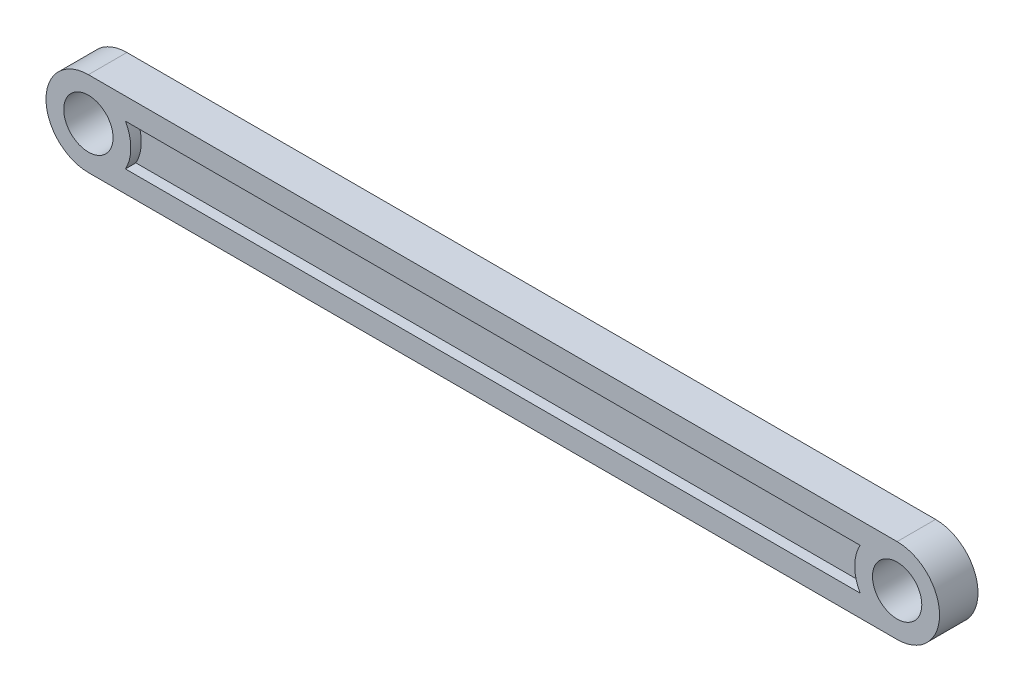
from build123d import *

# Parameters (mm, degrees)
SKETCH1_R           = 2.5
BOSS_EXTRUDE1_DEPTH = 1.95
CUT_EXTRUDE1_DEPTH  = 1.06


with BuildPart() as part:
    # Sketch1 → Boss-Extrude1 (new, symmetric)
    with BuildSketch(Plane.XY):
        with BuildLine():
            Line((41, -4.3), (-41, -4.3))
            ThreePointArc((-41, -4.3), (-45.3, 0), (-41, 4.3))
            Line((-41, 4.3), (41, 4.3))
            ThreePointArc((41, 4.3), (45.3, 0), (41, -4.3))
        make_face()
        with Locations((-41, 0)):
            Circle(SKETCH1_R, mode=Mode.SUBTRACT)
        with Locations((41, 0)):
            Circle(SKETCH1_R, mode=Mode.SUBTRACT)
    extrude(amount=BOSS_EXTRUDE1_DEPTH, both=True)

    # Sketch2 → Cut-Extrude1 (cut)
    with BuildSketch(Plane.XY.offset(1.95)):
        with BuildLine():
            ThreePointArc((37.247667392, -2.1), (36.7, 0), (37.247667392, 2.1))
            Line((37.247667392, 2.1), (-37.247667392, 2.1))
            ThreePointArc((-37.247667392, 2.1), (-36.83916894, 1.08511976), (-36.7, 0))
            ThreePointArc((-36.7, 0), (-36.83916894, -1.08511976), (-37.247667392, -2.1))
            Line((-37.247667392, -2.1), (37.247667392, -2.1))
        make_face()
    cut_extrude1 = extrude(amount=-CUT_EXTRUDE1_DEPTH, mode=Mode.SUBTRACT)

    # Mirror1: Cut-Extrude1 across plane
    add(cut_extrude1.mirror(Plane.XY), mode=Mode.SUBTRACT)


solid = part.part
